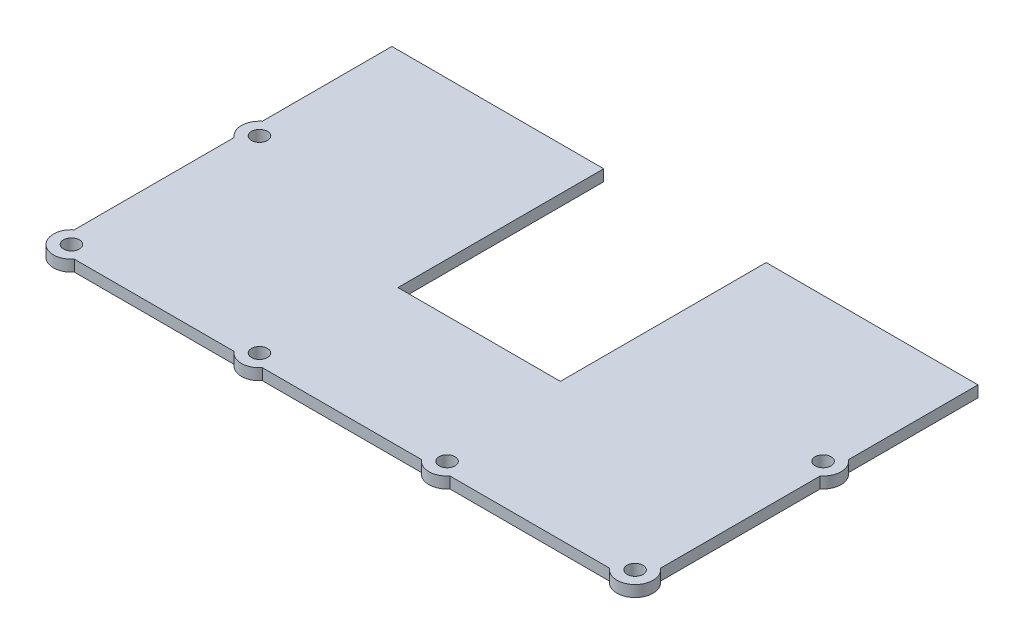
from build123d import *

# Parameters (mm, degrees)
SKETCH1_R           = 2.2479
BOSS_EXTRUDE1_DEPTH = 3.175


with BuildPart() as part:
    # Sketch1 → Boss-Extrude1 (new body)
    with BuildSketch(Plane(origin=(0, 0, 0), x_dir=(1, 0, 0), z_dir=(0, 1, 0))):
        with BuildLine():
            Line((59.6265, 0), (0, 0))
            Line((0, 0), (0, -36.474509804))
            ThreePointArc((0, -36.474509804), (-1.905, -40.440083533), (0, -44.405657262))
            Line((0, -44.405657262), (0, -89.391176471))
            ThreePointArc((0, -89.391176471), (-0.417102448, -96.948852648), (7.140573729, -96.5317502))
            Line((7.140573729, -96.5317502), (52.126092938, -96.5317502))
            ThreePointArc((52.126092938, -96.5317502), (56.091666667, -98.4367502), (60.057240396, -96.5317502))
            Line((60.057240396, -96.5317502), (63.5, -96.5317502))
            Line((63.5, -96.5317502), (69.85, -96.5317502))
            Line((69.85, -96.5317502), (95.25, -96.5317502))
            Line((95.25, -96.5317502), (101.6, -96.5317502))
            Line((101.6, -96.5317502), (104.917251774, -96.5317502))
            ThreePointArc((104.917251774, -96.5317502), (108.882825503, -98.4367502), (112.848399232, -96.5317502))
            Line((112.848399232, -96.5317502), (157.833918441, -96.5317502))
            ThreePointArc((157.833918441, -96.5317502), (165.391594618, -96.948852648), (164.97449217, -89.391176471))
            Line((164.97449217, -89.391176471), (164.97449217, -44.405657262))
            ThreePointArc((164.97449217, -44.405657262), (166.87949217, -40.440083533), (164.97449217, -36.474509804))
            Line((164.97449217, -36.474509804), (164.97449217, 0))
            Line((164.97449217, 0), (105.34799217, 0))
            Line((105.34799217, 0), (105.34799217, -57.9237502))
            Line((105.34799217, -57.9237502), (59.6265, -57.9237502))
            Line((59.6265, -57.9237502), (59.6265, 0))
        make_face()
        with Locations((3.175, -40.440083533)):
            Circle(SKETCH1_R, mode=Mode.SUBTRACT)
        with Locations((3.175, -93.3567502)):
            Circle(SKETCH1_R, mode=Mode.SUBTRACT)
        with Locations((56.091666667, -93.3567502)):
            Circle(SKETCH1_R, mode=Mode.SUBTRACT)
        with Locations((108.882825503, -93.3567502)):
            Circle(SKETCH1_R, mode=Mode.SUBTRACT)
        with Locations((161.79949217, -93.3567502)):
            Circle(SKETCH1_R, mode=Mode.SUBTRACT)
        with Locations((161.79949217, -40.440083533)):
            Circle(SKETCH1_R, mode=Mode.SUBTRACT)
    extrude(amount=BOSS_EXTRUDE1_DEPTH)


solid = part.part
